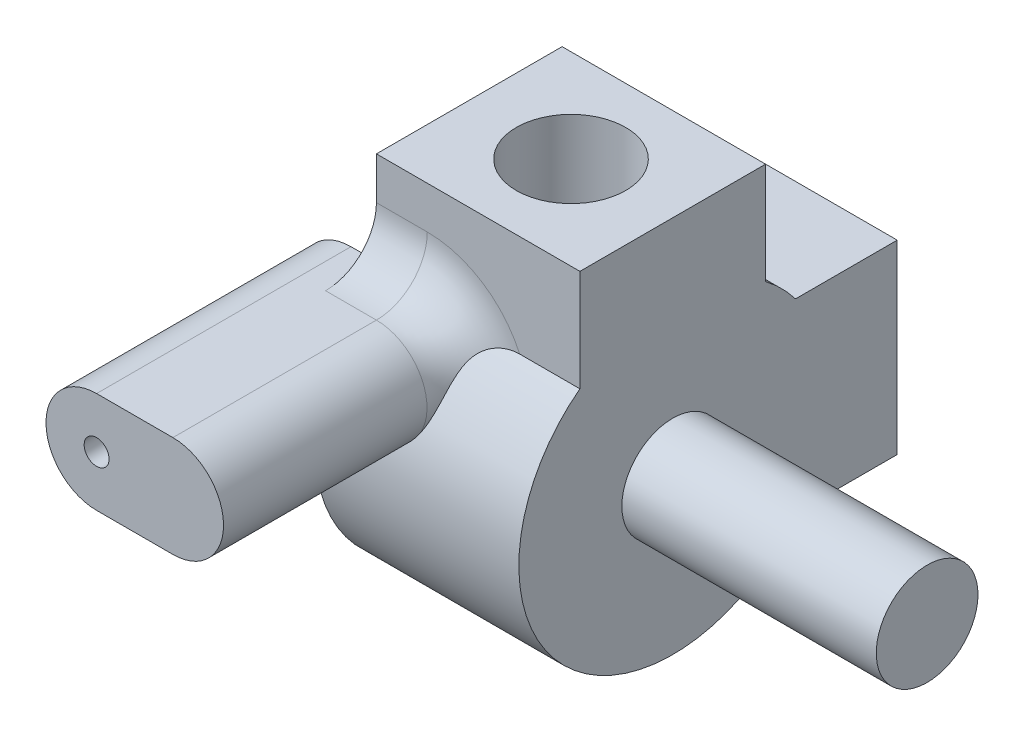
from build123d import *

# Parameters (mm, degrees)
SKETCH1_R               = 1.75
BOSS_EXTRUDE1_DEPTH     = 4
SKETCH2_R               = 2.15
CUT_EXTRUDE1_DEPTH      = 5
BOSS_EXTRUDE5_START     = -1.8499999
BOSS_EXTRUDE5_OUTLINE_R = 2
BOSS_EXTRUDE5_DEPTH     = 11.8499999
BOSS_EXTRUDE5_START_2   = -3
BOSS_EXTRUDE5_2_DEPTH   = 7.824935333
SKETCH3_R               = 2.15
CUT_EXTRUDE2_DEPTH      = 5
BOSS_EXTRUDE2_START     = 4
SKETCH4_W               = 8
SKETCH4_H               = 7.3
SKETCH4_R               = 2.15
BOSS_EXTRUDE2_DEPTH     = 4
BOSS_EXTRUDE3_START     = 4
SKETCH5_W               = 8
SKETCH5_H               = 7.3
SKETCH5_R               = 2.15
BOSS_EXTRUDE3_DEPTH     = 4
SKETCH6_R               = 0.4895
BOSS_EXTRUDE4_DEPTH     = 10
FILLET1_R               = 2


with BuildPart() as part:
    # Sketch1 → Boss-Extrude1 (new, symmetric)
    with BuildSketch(Plane(origin=(0, 0, 0), x_dir=(0, 0, -1), z_dir=(1, 0, 0))):
        with BuildLine():
            Line((-3.65, 4.824935233), (3.65, 4.824935233))
            ThreePointArc((3.65, 4.824935233), (4.277996026, 4.277996026), (4.824935233, 3.65))
            Line((4.824935233, 3.65), (4.824935233, -3.65))
            ThreePointArc((4.824935233, -3.65), (-4.277996026, -4.277996026), (-3.65, 4.824935233))
        make_face()
        Circle(SKETCH1_R, mode=Mode.SUBTRACT)
    extrude(amount=BOSS_EXTRUDE1_DEPTH, both=True)

    # Sketch2 → Cut-Extrude1 (cut)
    with BuildSketch(Plane(origin=(0, 4.824935233, 0), x_dir=(1, 0, 0), z_dir=(0, 1, 0))):
        with Locations(Location((0, 0, 0), (0, 0, 270))):
            Circle(SKETCH2_R)
    extrude(amount=-CUT_EXTRUDE1_DEPTH, mode=Mode.SUBTRACT)

    # Boss-Extrude5: read off the stored shape, not the designer's step
    # Boss-Extrude5 outline → Boss-Extrude5 (add)
    with BuildSketch(Plane(origin=(4, 0, 0), x_dir=(0, 0, -1), z_dir=(1, 0, 0)).offset(BOSS_EXTRUDE5_START)):
        Circle(BOSS_EXTRUDE5_OUTLINE_R)
    extrude(amount=BOSS_EXTRUDE5_DEPTH)

    # Boss-Extrude5 2 outline → Boss-Extrude5 2 (add)
    with BuildSketch(Plane(origin=(0, 0, 0), x_dir=(1, 0, 0), z_dir=(0, 1, 0)).offset(BOSS_EXTRUDE5_START_2)):
        with BuildLine():
            Line((2.1500001, -3), (2.15, 0))
            ThreePointArc((2.15, 0), (1.52027958, -1.52027958), (0, -2.15))
            Line((0, -2.15), (0, -3))
            Line((0, -3), (2.1500001, -3))
        make_face()
        with BuildLine():
            ThreePointArc((0, 2.15), (1.52027958, 1.52027958), (2.15, 0))
            Line((2.15, 0), (2.1500001, 3))
            Line((2.1500001, 3), (0, 3))
            Line((0, 3), (0, 2.15))
        make_face()
    extrude(amount=BOSS_EXTRUDE5_2_DEPTH)

    # Sketch3 → Cut-Extrude2 (cut)
    with BuildSketch(Plane(origin=(0, 0, -4.824935233), x_dir=(-1, 0, 0), z_dir=(0, 0, -1))):
        Circle(SKETCH3_R)
    extrude(amount=-CUT_EXTRUDE2_DEPTH, mode=Mode.SUBTRACT)

    # Sketch4 → Boss-Extrude2 (add)
    with BuildSketch(Plane(origin=(0, 4.824935233, 0), x_dir=(1, 0, 0), z_dir=(0, 1, 0)).offset(BOSS_EXTRUDE2_START)):
        Rectangle(SKETCH4_W, SKETCH4_H)
        with Locations(Location((0, 0, 0), (0, 0, 270))):
            Circle(SKETCH4_R, mode=Mode.SUBTRACT)
    extrude(amount=-BOSS_EXTRUDE2_DEPTH)

    # Sketch5 → Boss-Extrude3 (add)
    with BuildSketch(Plane(origin=(0, 0, -4.824935233), x_dir=(-1, 0, 0), z_dir=(0, 0, -1)).offset(BOSS_EXTRUDE3_START)):
        Rectangle(SKETCH5_W, SKETCH5_H)
        Circle(SKETCH5_R, mode=Mode.SUBTRACT)
    extrude(amount=-BOSS_EXTRUDE3_DEPTH)

    # Sketch6 → Boss-Extrude4 (add)
    with BuildSketch(Plane.XY.offset(3.65)):
        with BuildLine():
            Line((-2, 5.1645), (-5, 5.1645))
            ThreePointArc((-5, 5.1645), (-6.9895, 3.175), (-5, 1.1855))
            Line((-5, 1.1855), (-2, 1.1855))
            ThreePointArc((-2, 1.1855), (-0.0105, 3.175), (-2, 5.1645))
        make_face()
        with Locations((-5, 3.175)):
            Circle(SKETCH6_R, mode=Mode.SUBTRACT)
    extrude(amount=BOSS_EXTRUDE4_DEPTH)

    # Fillet1
    # the kernel refuses this fillet: 2 mm, written as the material it adds along each edge
    with BuildSketch(Plane(origin=(-2, 3.175, 3.65), x_dir=(0.03534330894551541, -0.9993752300876693, 0), z_dir=(-0.9993752300876693, -0.03534330894551541, 0))) as fillet1_piece_1:
        with BuildLine():
            CenterArc((1.9895 + FILLET1_R, FILLET1_R), FILLET1_R, 180, 90)
            Line((1.9895 + FILLET1_R, 0), (1.9895, 0))
            Line((1.9895, 0), (1.9895, FILLET1_R))
        make_face()
    revolve(axis=Axis((-2, 3.175, 3.65), (0, 0, 1)), revolution_arc=177.974555734)
    with BuildSketch(Plane(origin=(-2, 5.1645, 3.65), x_dir=(0, 0, 1), z_dir=(-1, 0, 0))) as fillet1_piece_2:
        with BuildLine():
            CenterArc((FILLET1_R, FILLET1_R), FILLET1_R, 180, 90)
            Line((0, FILLET1_R), (0, 0))
            Line((0, 0), (FILLET1_R, 0))
        make_face()
    extrude(amount=2)


solid = part.part
